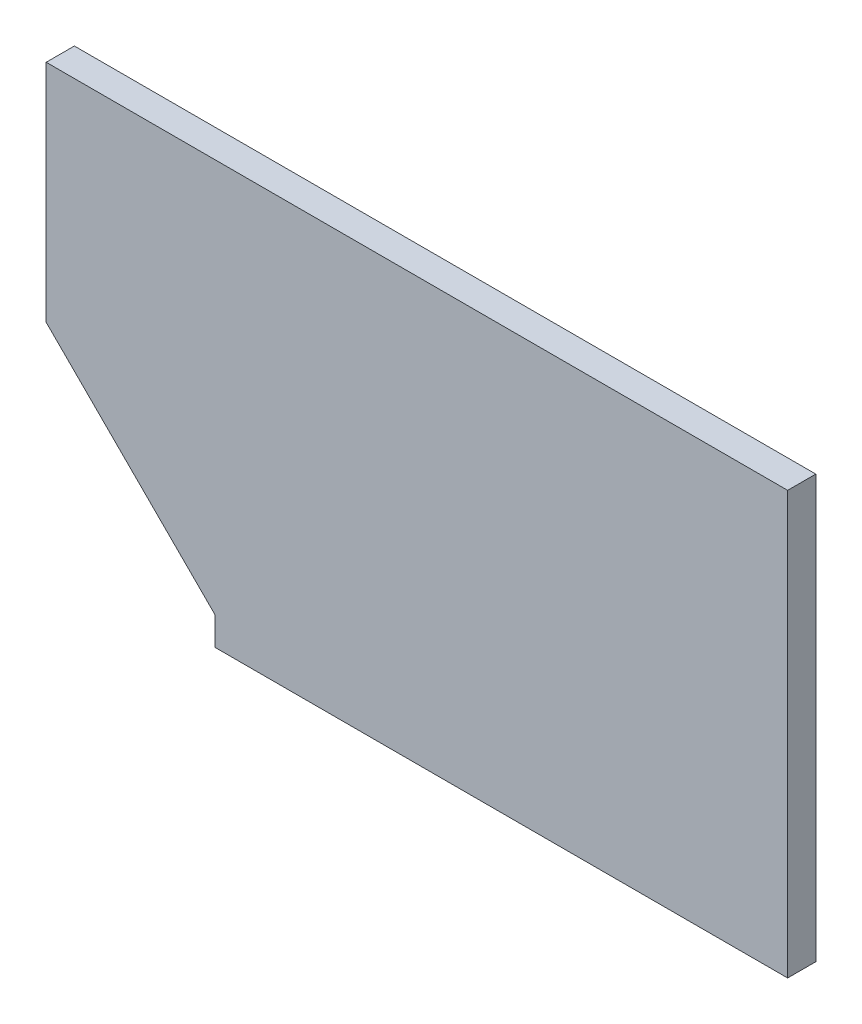
from build123d import *

# Parameters (mm, degrees)
BOSS_EXTRUDE1_DEPTH = 3


with BuildPart() as part:
    # Sketch1 → Boss-Extrude1 (new body)
    with BuildSketch(Plane.XY):
        Polygon((0, 0), (0, -45), (-61, -45), (-61, -42), (-79, -24), (-79, 0), align=None)
    extrude(amount=-BOSS_EXTRUDE1_DEPTH)


solid = part.part
